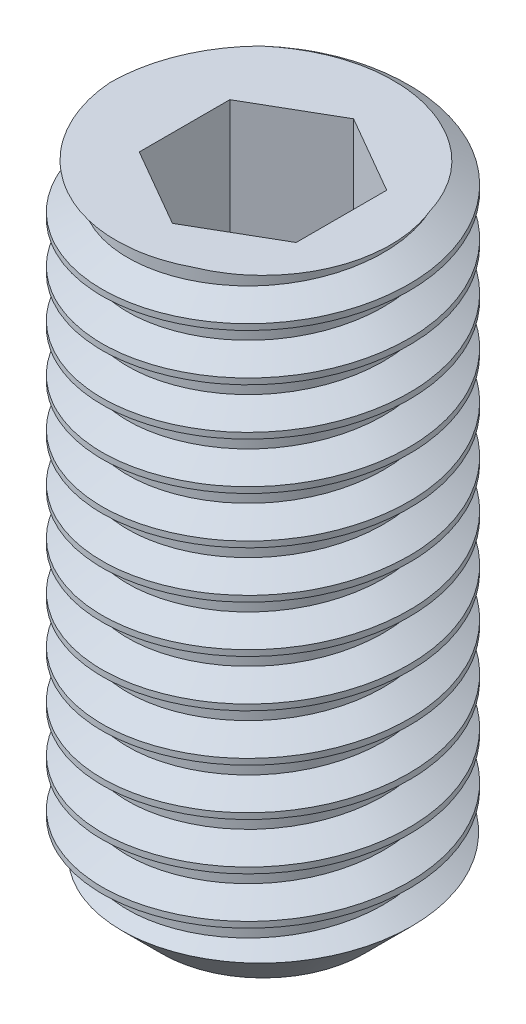
from build123d import *

# Parameters (mm, degrees)
SKETCH1_R           = 1.465
BOSS_EXTRUDE1_DEPTH = 6
CHAMFER1_SIZE       = 0.5
CUT_EXTRUDE1_DEPTH  = 1.5
THREAD1_PITCH       = 0.45


with BuildPart() as part:
    # Sketch1 → Boss-Extrude1 (new body)
    with BuildSketch(Plane(origin=(0, 0, 0), x_dir=(1, 0, 0), z_dir=(0, 1, 0))):
        with Locations(Location((0, 0, 0), (0, 0, 270))):
            Circle(SKETCH1_R)
    extrude(amount=BOSS_EXTRUDE1_DEPTH)

    # Chamfer1
    chamfer1_edges = [part.edges().sort_by_distance(p)[0] for p in [
        (0, 0, -1.465),
    ]]
    chamfer(chamfer1_edges, length=CHAMFER1_SIZE)

    # Sketch2 → Cut-Extrude1 (cut)
    with BuildSketch(Plane(origin=(0, 6, 0), x_dir=(1, 0, 0), z_dir=(0, 1, 0))):
        Polygon((0, -0.866025404), (0.75, -0.433012702), (0.75, 0.433012702), (0, 0.866025404), (-0.75, 0.433012702), (-0.75, -0.433012702), align=None)
    extrude(amount=-CUT_EXTRUDE1_DEPTH, mode=Mode.SUBTRACT)

    # Thread1: the profile of Thread Profile1 profile screwed along a right-hand helix of 14.333333 turns, 6 arcs to a turn; built about Z, then put on its axis
    thread1_z = Axis((0, 0, 0), (0, 0, 1))
    thread1_corners = [(1.4653, 0, -0.000173205), (1.4653, 0, 0.393923204), (1.221430356, 0, 0.253124999), (1.221430356, 0, 0.140624999)]
    with BuildLine(mode=Mode.PRIVATE) as thread1_profile:
        Line(thread1_corners[0], thread1_corners[1])
        Line(thread1_corners[1], thread1_corners[2])
        Line(thread1_corners[2], thread1_corners[3])
        Line(thread1_corners[3], thread1_corners[0])
    thread1_cap = Face(thread1_profile.wire())
    thread1_turn_angles = [0, 30, 60, 90, 120, 150, 180, 210, 240, 270, 300, 330, 360]
    thread1_turn_weights = [1, 0.8660254037844387, 1, 0.8660254037844387, 1, 0.8660254037844387, 1, 0.8660254037844387, 1, 0.8660254037844387, 1, 0.8660254037844387, 1]
    thread1_turn_rails = [Edge.make_bspline([Vector(p[0], p[1], 0).rotate(thread1_z, thread1_turn_angles[k]) / thread1_turn_weights[k] + Vector(0, 0, p[2] + THREAD1_PITCH * thread1_turn_angles[k] / 360) for k in range(13)], [0, 0, 0, 1, 1, 2, 2, 3, 3, 4, 4, 5, 5, 6, 6, 6], 2, thread1_turn_weights) for p in thread1_corners]
    thread1_turn_sides = [Face.make_surface_from_curves(thread1_turn_rails[p[0]], thread1_turn_rails[p[1]]) for p in [(0, 1), (1, 2), (2, 3), (3, 0)]]
    thread1_last_angles = [5040, 5070, 5100, 5130, 5160]
    thread1_last_weights = [1, 0.8660254037844387, 1, 0.8660254037844347, 1]
    thread1_last_rails = [Edge.make_bspline([Vector(p[0], p[1], 0).rotate(thread1_z, thread1_last_angles[k]) / thread1_last_weights[k] + Vector(0, 0, p[2] + THREAD1_PITCH * thread1_last_angles[k] / 360) for k in range(5)], [0, 0, 0, 1, 1, 2, 2, 2], 2, thread1_last_weights) for p in thread1_corners]
    thread1_last_sides = [Face.make_surface_from_curves(thread1_last_rails[p[0]], thread1_last_rails[p[1]]) for p in [(0, 1), (1, 2), (2, 3), (3, 0)]]
    thread1 = Plane(origin=(0, 6.45, 0), x_dir=(-1, 0, 0), z_dir=(0, -1, 0)) * Solid(Shell([*[p.moved(Location((0, 0, THREAD1_PITCH * i))) for i in range(14) for p in thread1_turn_sides], *thread1_last_sides, thread1_cap, thread1_cap.rotate(thread1_z, 5160).moved(Location((0, 0, THREAD1_PITCH * 5160 / 360)))]))
    add(thread1, mode=Mode.SUBTRACT)


solid = part.part
